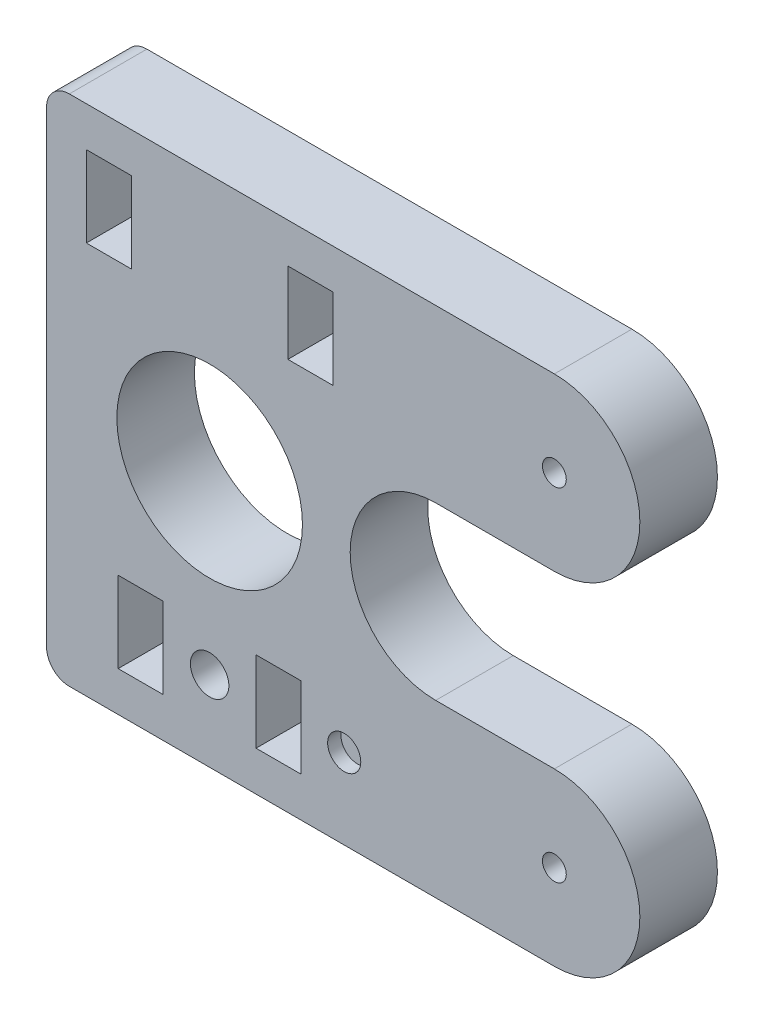
from build123d import *

# Parameters (mm, degrees)
SKETCH1_R           = 0.9
SKETCH1_R_2         = 1.45
SKETCH1_R_3         = 7
SKETCH1_W           = 3.400011
SKETCH1_H           = 6.1
SKETCH1_W_2         = 3.4
BOSS_EXTRUDE2_DEPTH = 5.85
SKETCH2_R           = 1.25
CUT_EXTRUDE1_DEPTH  = 1


with BuildPart() as part:
    # Sketch1 → Boss-Extrude2 (new body)
    with BuildSketch(Plane.XY):
        with BuildLine():
            Line((669.63684417, 350.11545661), (648.1438119, 350.11545661))
            ThreePointArc((648.1438119, 350.11545661), (646.929496344, 349.612470637), (646.426510371, 348.398155081))
            Line((646.426510371, 348.398155081), (646.426510371, 313.132758138))
            ThreePointArc((646.426510371, 313.132758138), (646.929496344, 311.918442582), (648.1438119, 311.41545661))
            Line((648.1438119, 311.41545661), (669.63684417, 311.41545661))
            Line((669.63684417, 311.41545661), (684.726521371, 311.41545661))
            ThreePointArc((684.726521371, 311.41545661), (691.176521371, 317.86545661), (684.726521371, 324.31545661))
            Line((684.726521371, 324.31545661), (675.776521371, 324.31545661))
            ThreePointArc((675.776521371, 324.31545661), (669.326521371, 330.76545661), (675.776521371, 337.21545661))
            Line((675.776521371, 337.21545661), (684.726521371, 337.21545661))
            ThreePointArc((684.726521371, 337.21545661), (691.176521371, 343.66545661), (684.726521371, 350.11545661))
            Line((684.726521371, 350.11545661), (669.63684417, 350.11545661))
        make_face()
        with Locations((684.726521371, 343.66545661)):
            Circle(SKETCH1_R, mode=Mode.SUBTRACT)
        with Locations((684.726521371, 317.86545661)):
            Circle(SKETCH1_R, mode=Mode.SUBTRACT)
        with Locations((658.726521371, 317.46545661)):
            Circle(SKETCH1_R_2, mode=Mode.SUBTRACT)
        with Locations((658.726521371, 330.76545661)):
            Circle(SKETCH1_R_3, mode=Mode.SUBTRACT)
        with Locations((651.126515871, 344.06545661)):
            Rectangle(SKETCH1_W, SKETCH1_H, mode=Mode.SUBTRACT)
        with Locations((653.526521371, 317.46545661)):
            Rectangle(SKETCH1_W_2, SKETCH1_H, mode=Mode.SUBTRACT)
        with Locations((666.326526871, 344.06545661)):
            Rectangle(SKETCH1_W, SKETCH1_H, mode=Mode.SUBTRACT)
        with Locations((663.926521371, 317.46545661)):
            Rectangle(SKETCH1_W_2, SKETCH1_H, mode=Mode.SUBTRACT)
    extrude(amount=BOSS_EXTRUDE2_DEPTH)

    # Sketch2 → Cut-Extrude1 (cut)
    with BuildSketch(Plane.XY.offset(5.85)):
        with Locations((668.876521371, 317.46545661)):
            Circle(SKETCH2_R)
    extrude(amount=-CUT_EXTRUDE1_DEPTH, mode=Mode.SUBTRACT)


solid = part.part
